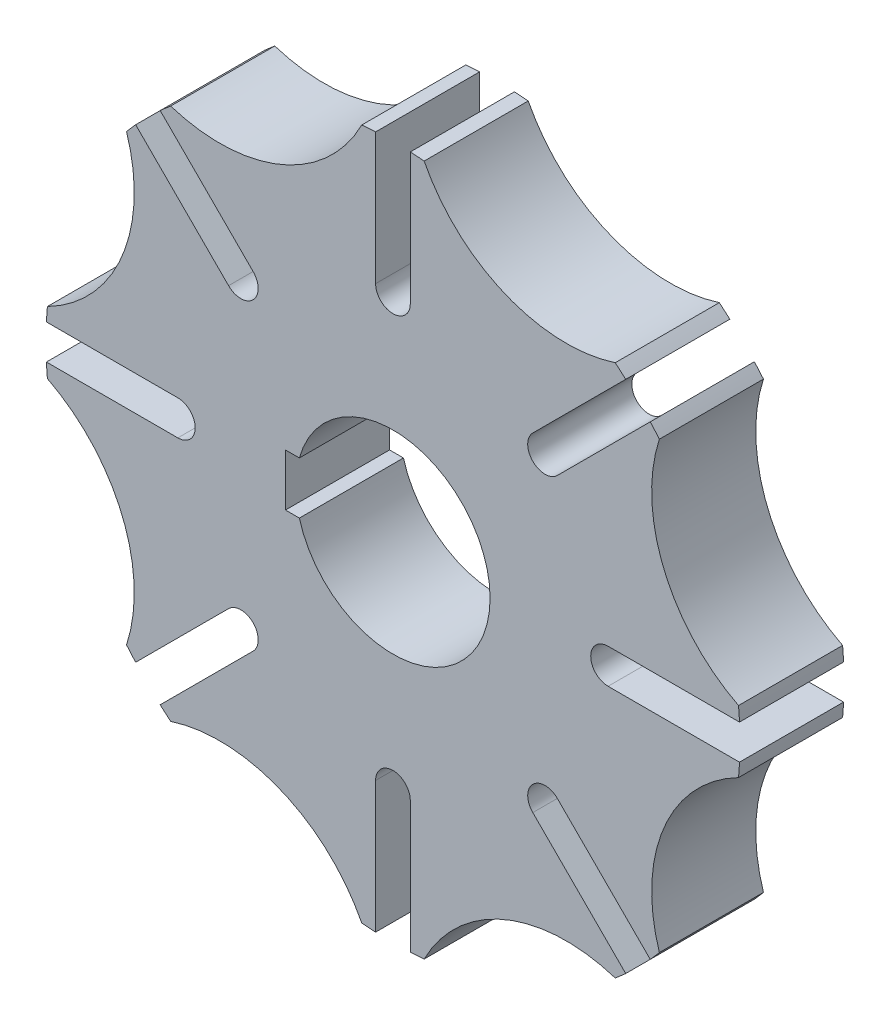
from build123d import *

# Parameters (mm, degrees)
SKETCH1_R           = 100
BOSS_EXTRUDE1_DEPTH = 15
CUT_EXTRUDE2_START  = -30
CUT_EXTRUDE2_DEPTH  = 30
CIRPATTERN1_COUNT   = 8
CUT_EXTRUDE3_DEPTH  = 30
CIRPATTERN2_COUNT   = 8
CUT_EXTRUDE4_DEPTH  = 35


# Read off the part's stored shape, not the designer's step: Cut-Extrude2
with BuildPart() as part:
    # Sketch1 → Boss-Extrude1 (new, symmetric)
    with BuildSketch(Plane.XY):
        Circle(SKETCH1_R)
    extrude(amount=BOSS_EXTRUDE1_DEPTH, both=True)

    # Cut-Extrude2 outline → Cut-Extrude2 (cut)
    with BuildSketch(Plane.XY.offset(15).offset(CUT_EXTRUDE2_START)):
        with BuildLine():
            ThreePointArc((62, 5), (57, 0), (62, -5))
            Line((62, -5), (99.874921777, -5))
            ThreePointArc((99.874921777, -5), (100, 0), (99.874921777, 5))
            Line((99.874921777, 5), (62, 5))
        make_face()
    cut_extrude2 = extrude(amount=CUT_EXTRUDE2_DEPTH, mode=Mode.SUBTRACT)

    # CirPattern1: Cut-Extrude2 ×8 about axis
    cirpattern1_axis = Axis((0, 0, 15), (0, 0, -1))
    for i in range(1, CIRPATTERN1_COUNT):
        add(cut_extrude2.rotate(cirpattern1_axis, i * 360 / CIRPATTERN1_COUNT), mode=Mode.SUBTRACT)

    # Sketch8 → Cut-Extrude3 (cut)
    with BuildSketch(Plane.XY.offset(15)):
        with BuildLine():
            ThreePointArc((76.781373425, 64.06731378), (78.062131756, 32.338894345), (99.594176537, 9))
            ThreePointArc((99.594176537, 9), (92.386069934, 38.27288965), (76.781373425, 64.06731378))
        make_face()
    cut_extrude3 = extrude(amount=-CUT_EXTRUDE3_DEPTH, mode=Mode.SUBTRACT)

    # CirPattern2: Cut-Extrude3 ×8 about axis
    cirpattern2_axis = Axis((0, 0, 0), (0, 0, 1))
    for i in range(1, CIRPATTERN2_COUNT):
        add(cut_extrude3.rotate(cirpattern2_axis, i * 360 / CIRPATTERN2_COUNT), mode=Mode.SUBTRACT)

    # Sketch9 → Cut-Extrude4 (cut, symmetric)
    with BuildSketch(Plane.XY.offset(15)):
        with BuildLine():
            Line((-26.97684192, 7.5), (-30.97684192, 7.5))
            Line((-30.97684192, 7.5), (-30.97684192, -7.5))
            Line((-30.97684192, -7.5), (-26.97684192, -7.5))
            ThreePointArc((-26.97684192, -7.5), (28, 0), (-26.97684192, 7.5))
        make_face()
    extrude(amount=CUT_EXTRUDE4_DEPTH, both=True, mode=Mode.SUBTRACT)


solid = part.part
